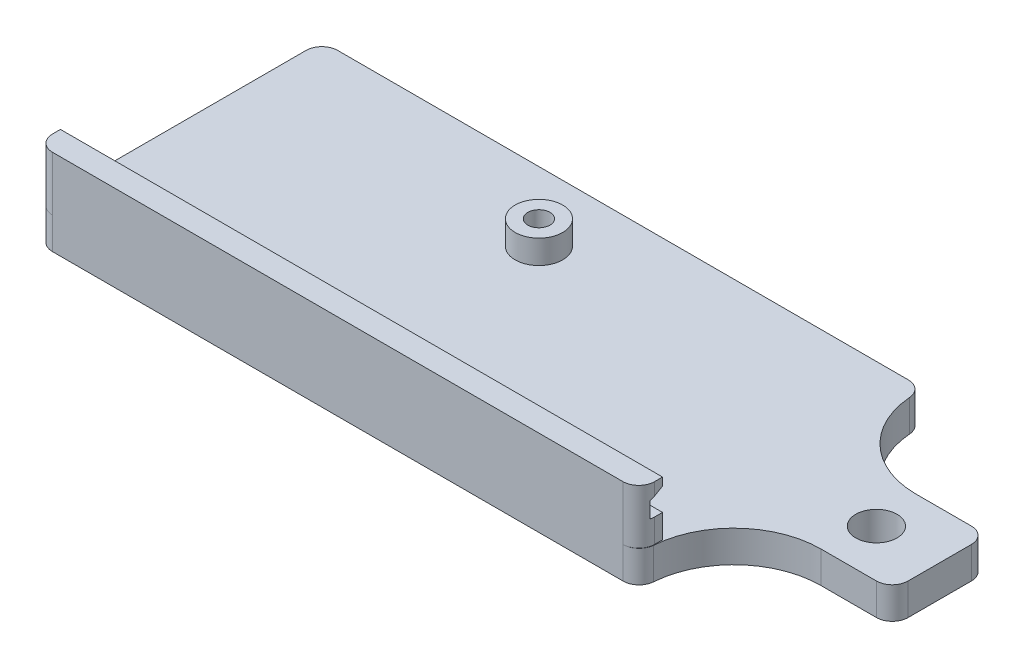
from build123d import *

# Parameters (mm, degrees)
BOSS_EXTRUDE1_DEPTH     = 4
BOSS_EXTRUDE2_DEPTH     = 76
FILLET1_R               = 2
SKETCH3_R               = 3
BOSS_EXTRUDE3_DEPTH     = 3
CUT_EXTRUDE1_DEPTH      = 103.757687
CUT_EXTRUDE1_DEPTH_BACK = 103.757687
SKETCH4_R               = 2.6
SKETCH4_R_2             = 1.4


with BuildPart() as part:
    # Sketch1 → Boss-Extrude1 (new body)
    with BuildSketch(Plane(origin=(0, 0, 0), x_dir=(1, 0, 0), z_dir=(0, 1, 0))):
        with BuildLine():
            Line((2, 0), (74.038519, 0))
            ThreePointArc((74.038519, 0), (75.397251, -0.532401), (76.032593, -1.846154))
            ThreePointArc((76.032593, -1.846154), (79.526972, -9.071793), (87, -12))
            Line((87, -12), (94, -12))
            ThreePointArc((94, -12), (95.414214, -12.585786), (96, -14))
            Line((96, -14), (96, -22))
            ThreePointArc((96, -22), (95.414214, -23.414214), (94, -24))
            Line((94, -24), (87, -24))
            ThreePointArc((87, -24), (79.526972, -26.928207), (76.032593, -34.153846))
            ThreePointArc((76.032593, -34.153846), (75.397251, -35.467599), (74.038519, -36))
            Line((74.038519, -36), (2, -36))
            ThreePointArc((2, -36), (0.585786, -35.414214), (0, -34))
            Line((0, -34), (0, -2))
            ThreePointArc((0, -2), (0.585786, -0.585786), (2, 0))
        make_face()
    extrude(amount=BOSS_EXTRUDE1_DEPTH)

    # Sketch2 → Boss-Extrude2 (add)
    with BuildSketch(Plane.ZY):
        Polygon((36, 4), (36, 10.866025), (33, 10.866025), (33, 9.866025), (34.5, 9), (34.5, 7), (33, 7), (33, 4), align=None)
    extrude(amount=-BOSS_EXTRUDE2_DEPTH)

    # Fillet1
    # the kernel refuses this fillet: 2 mm, written as the material it takes off along each edge
    with BuildSketch(Plane(origin=(0, -1, 36), x_dir=(0, 0, -1), z_dir=(0, 1, 0))) as fillet1_piece_1:
        with BuildLine():
            CenterArc((FILLET1_R, -FILLET1_R), FILLET1_R, 90, 90)
            Line((0, -FILLET1_R), (0, 0))
            Line((0, 0), (FILLET1_R, 0))
        make_face()
    extrude(amount=16.866025, mode=Mode.SUBTRACT)
    with BuildSketch(Plane(origin=(76, -1, 36), x_dir=(-1, 0, 0), z_dir=(0, 1, 0))) as fillet1_piece_2_section:
        with BuildLine():
            CenterArc((FILLET1_R, -FILLET1_R), FILLET1_R, 90, 90)
            Line((0, -FILLET1_R), (0, 0))
            Line((0, 0), (FILLET1_R, 0))
        make_face()
    fillet1_piece_2 = extrude(amount=16.866025, mode=Mode.PRIVATE)
    fillet1_piece_2 = fillet1_piece_2 - Plane(origin=(74.038519, 2, 34), x_dir=(0.9970370305242855, 0, 0.07692307692308645), z_dir=(0, -1, 0)) * Cylinder(2, 42, mode=Mode.PRIVATE)
    add(fillet1_piece_2, mode=Mode.SUBTRACT)
    with BuildSketch(Plane(origin=(76, 4, 36), x_dir=(-1, 0, 0), z_dir=(0, 1, 0))) as fillet1_piece_3:
        with BuildLine():
            CenterArc((FILLET1_R, -FILLET1_R), FILLET1_R, 90, 90)
            Line((0, -FILLET1_R), (0, 0))
            Line((0, 0), (FILLET1_R, 0))
        make_face()
    extrude(amount=11.866025, mode=Mode.SUBTRACT)

    # Sketch3 → Boss-Extrude3 (add)
    with BuildSketch(Plane(origin=(0, 4, 0), x_dir=(1, 0, 0), z_dir=(0, 1, 0))):
        with Locations(Location((36.1, -8.7, 0), (0, 0, 270))):
            Circle(SKETCH3_R)
    extrude(amount=BOSS_EXTRUDE3_DEPTH)

    # Sketch4 → Cut-Extrude1 (cut, two sides: drawn at the far end of the back side and taken through both)
    with BuildSketch(Plane(origin=(0, 4, 0), x_dir=(1, 0, 0), z_dir=(0, 1, 0)).offset(-CUT_EXTRUDE1_DEPTH_BACK)):
        with Locations(Location((88, -18, 0), (0, 0, 270))):
            Circle(SKETCH4_R)
        with Locations(Location((36.1, -8.7, 0), (0, 0, 270))):
            Circle(SKETCH4_R_2)
    extrude(amount=CUT_EXTRUDE1_DEPTH + CUT_EXTRUDE1_DEPTH_BACK, mode=Mode.SUBTRACT)


solid = part.part
